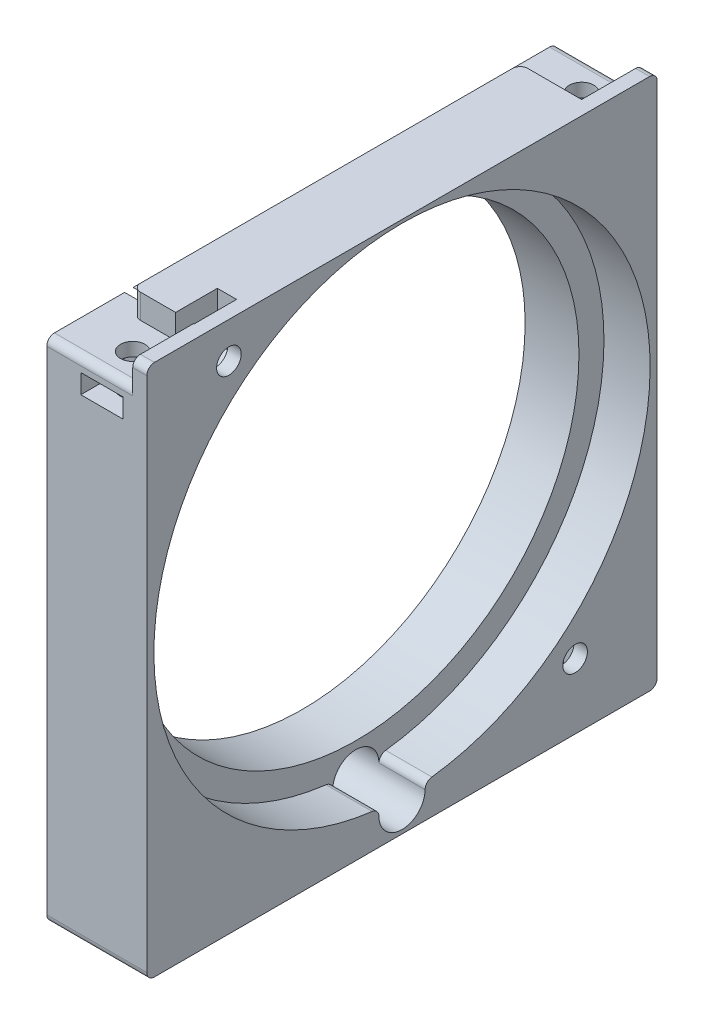
from build123d import *

# Parameters (mm, degrees)
SKETCH1_W                = 66.35
SKETCH1_H                = 69.18
SKETCH1_R                = 29
BOSS_EXTRUDE1_DEPTH      = 7
SKETCH3_W                = 66.35
SKETCH3_H                = 69.18
SKETCH3_R                = 32.25
BOSS_EXTRUDE2_DEPTH      = 6
CUT_EXTRUDE1_DEPTH       = 3.18
CUT_EXTRUDE5_DEPTH       = 1.25
M3_CLEARANCE_HOLE3_D     = 3.2
M3_CLEARANCE_HOLE3_DEPTH = 10
M3_CLEARANCE_HOLE3_TIP   = 0.96137699
SKETCH14_R               = 3
CUT_EXTRUDE3_DEPTH       = 11
CUT_EXTRUDE4_DEPTH       = 1.25
M3_CLEARANCE_HOLE2_D     = 3.2
FILLET1_R                = 1


with BuildPart() as part:
    # Sketch1 → Boss-Extrude1 (new body)
    with BuildSketch(Plane(origin=(0, 0, 0), x_dir=(0, 0, -1), z_dir=(1, 0, 0))):
        Rectangle(SKETCH1_W, SKETCH1_H)
        with Locations((0, 1.91)):
            Circle(SKETCH1_R, mode=Mode.SUBTRACT)
    extrude(amount=BOSS_EXTRUDE1_DEPTH)

    # Sketch3 → Boss-Extrude2 (add)
    with BuildSketch(Plane(origin=(7, 0, 0), x_dir=(0, 0, -1), z_dir=(1, 0, 0))):
        Rectangle(SKETCH3_W, SKETCH3_H)
        with Locations((0, 1.91)):
            Circle(SKETCH3_R, mode=Mode.SUBTRACT)
    extrude(amount=BOSS_EXTRUDE2_DEPTH)

    # Sketch5 → Cut-Extrude1 (cut)
    with BuildSketch(Plane(origin=(0, 34.59, 0), x_dir=(1, 0, 0), z_dir=(0, 1, 0))):
        Polygon((3.175, 33.175), (11.175, 33.175), (11.175, 25.175), (3.175, 25.175), (3.175, -25.175), (11.175, -25.175), (11.175, -33.175), (3.175, -33.175), (0, -33.175), (0, 33.175), align=None)
    extrude(amount=-CUT_EXTRUDE1_DEPTH, mode=Mode.SUBTRACT)

    # Sketch8 → Cut-Extrude5 (cut, symmetric)
    with BuildSketch(Plane(origin=(0, 28.41, 0), x_dir=(1, 0, 0), z_dir=(0, 1, 0))):
        Polygon((4.425, -30.76271324), (4.425, -33.175), (9.925, -33.175), (9.925, -30.76271324), (9.925, -27.58728676), (7.175, -25.999573519), (4.425, -27.58728676), align=None)
        Polygon((4.425, 30.76271324), (4.425, 27.58728676), (7.175, 25.999573519), (9.925, 27.58728676), (9.925, 30.76271324), (9.925, 33.175), (4.425, 33.175), align=None)
    extrude(amount=CUT_EXTRUDE5_DEPTH, both=True, mode=Mode.SUBTRACT)

    # M3 Clearance Hole3
    with Locations(Plane(origin=(0, 31.41, 0), x_dir=(1, 0, 0), z_dir=(0, 1, 0))):
        with Locations((7.175, 29.175), (7.175, -29.175)):
            Hole(M3_CLEARANCE_HOLE3_D / 2, depth=M3_CLEARANCE_HOLE3_DEPTH)
            with Locations((0, 0, -(M3_CLEARANCE_HOLE3_DEPTH + M3_CLEARANCE_HOLE3_TIP / 2))):  # 118° drill point
                Cone(0, M3_CLEARANCE_HOLE3_D / 2, M3_CLEARANCE_HOLE3_TIP, mode=Mode.SUBTRACT)

    # Sketch14 → Cut-Extrude3 (cut)
    with BuildSketch(Plane(origin=(13, 0, 0), x_dir=(0, 0, -1), z_dir=(1, 0, 0))):
        with Locations(Location((0, -31.09, 0), (0, 0, 17.014495586))):
            Circle(SKETCH14_R)
    extrude(amount=-CUT_EXTRUDE3_DEPTH, mode=Mode.SUBTRACT)

    # Sketch15 → Cut-Extrude4 (cut, symmetric)
    with BuildSketch(Plane(origin=(10, 0, 0), x_dir=(0, 0, -1), z_dir=(1, 0, 0))):
        Polygon((19.75, -27.67771324), (19.75, -34.59), (25.25, -34.59), (25.25, -27.67771324), (25.25, -24.50228676), (22.5, -22.914573519), (19.75, -24.50228676), align=None)
        Polygon((-25.25, 31.49771324), (-25.25, 28.32228676), (-22.5, 26.734573519), (-19.75, 28.32228676), (-19.75, 31.49771324), (-19.75, 34.59), (-25.25, 34.59), align=None)
    extrude(amount=CUT_EXTRUDE4_DEPTH, both=True, mode=Mode.SUBTRACT)

    # M3 Clearance Hole2 (through all)
    with Locations(Plane(origin=(13, 0, 0), x_dir=(0, 0, -1), z_dir=(1, 0, 0))):
        with Locations((0, -31.09), (-22.5, 29.91), (22.5, -26.09)):
            Hole(M3_CLEARANCE_HOLE2_D / 2)

    # Fillet1
    # the kernel refuses this fillet: 1 mm, written as the material it takes off along each edge
    with BuildSketch(Plane(origin=(15.541447309, -30.212159091, -2.86869227), x_dir=(0, 0.10463908586340893, -0.9945102622445231), z_dir=(-1, 0, 0))) as fillet1_piece_1:
        with BuildLine():
            CenterArc((1.032339837, 0.999875789), FILLET1_R, 186.128452326, 82.968476456)
            ThreePointArc((0.038054785, 0.893117956), (0.052480052, 0.445133596), (0, 0))
            ThreePointArc((0, 0), (0.508289462, 0.004005802), (1.016578924, 0))
        make_face()
    extrude(amount=8.541447309, mode=Mode.SUBTRACT)
    with BuildSketch(Plane(origin=(15.541447309, -30.212159091, 2.86869227), x_dir=(0, 0.10463908586340893, 0.9945102622445231), z_dir=(-1, 0, 0))) as fillet1_piece_2:
        with BuildLine():
            CenterArc((1.032339837, -0.999875789), FILLET1_R, 90.903071218, 82.968476456)
            ThreePointArc((0.038054785, -0.893117956), (0.052480052, -0.445133596), (0, 0))
            ThreePointArc((0, 0), (0.508289462, -0.004005802), (1.016578924, 0))
        make_face()
    extrude(amount=8.541447309, mode=Mode.SUBTRACT)
    with BuildSketch(Plane(origin=(3.175, 37.09, -25.175), x_dir=(1, 0, 0), z_dir=(0, -1, 0)), Plane(origin=(3.175, 37.09, 25.175), x_dir=(0, 0, -1), z_dir=(0, -1, 0))) as fillet1_piece_3:
        with BuildLine():
            CenterArc((FILLET1_R, FILLET1_R), FILLET1_R, 180, 90)
            Line((0, FILLET1_R), (0, 0))
            Line((0, 0), (FILLET1_R, 0))
        make_face()
    extrude(amount=5.68, mode=Mode.SUBTRACT)
    with BuildSketch(Plane(origin=(11.175, 31.41, -33.175), x_dir=(0, -1, 0), z_dir=(-1, 0, 0)), Plane(origin=(-2.5, 31.41, 33.175), x_dir=(0, -1, 0), z_dir=(1, 0, 0))) as fillet1_piece_4:
        with BuildLine():
            CenterArc((FILLET1_R, FILLET1_R), FILLET1_R, 180, 90)
            Line((0, FILLET1_R), (0, 0))
            Line((0, 0), (FILLET1_R, 0))
        make_face()
    extrude(amount=13.675, mode=Mode.SUBTRACT)
    with BuildSketch(Plane(origin=(-2.5, -34.59, -33.175), x_dir=(0, 0, 1), z_dir=(1, 0, 0)), Plane(origin=(15.5, -34.59, 33.175), x_dir=(0, 0, -1), z_dir=(-1, 0, 0))) as fillet1_piece_5:
        with BuildLine():
            CenterArc((FILLET1_R, -FILLET1_R), FILLET1_R, 90, 90)
            Line((0, -FILLET1_R), (0, 0))
            Line((0, 0), (FILLET1_R, 0))
        make_face()
    extrude(amount=18, mode=Mode.SUBTRACT)
    with BuildSketch(Plane(origin=(15.5, 34.59, 33.175), x_dir=(0, -1, 0), z_dir=(-1, 0, 0)), Plane(origin=(8.675, 34.59, -33.175), x_dir=(0, -1, 0), z_dir=(1, 0, 0))) as fillet1_piece_6:
        with BuildLine():
            CenterArc((FILLET1_R, -FILLET1_R), FILLET1_R, 90, 90)
            Line((0, -FILLET1_R), (0, 0))
            Line((0, 0), (FILLET1_R, 0))
        make_face()
    extrude(amount=6.825, mode=Mode.SUBTRACT)


solid = part.part
